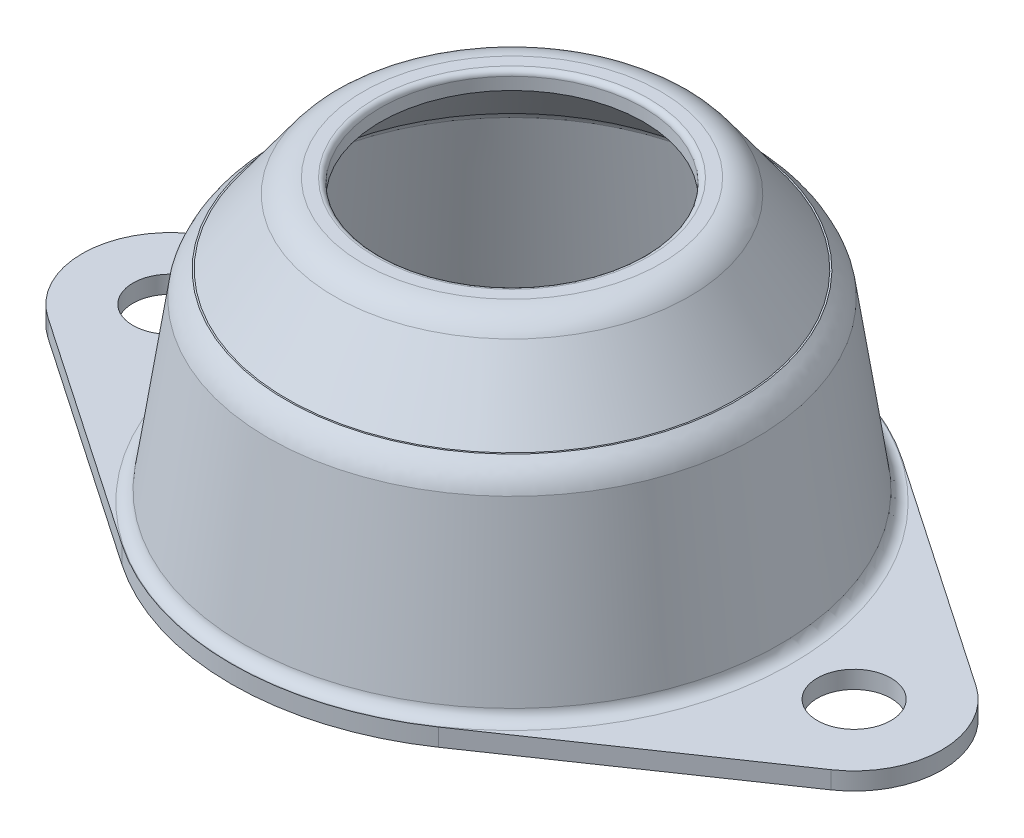
from build123d import *

# Parameters (mm, degrees)
R_VOL_MINCE1_OUTLINE_W   = 0.007571627
R_VOL_MINCE1_OUTLINE_H   = 0.3920495
R_VOL_MINCE1_OUTLINE_W_2 = 0.976658528
R_VOL_MINCE1_OUTLINE_H_2 = 0.231591764
ESQUISSE2_R              = 2.1
ESQUISSE2_R_2            = 14.5
BOSS_EXTRU_1_DEPTH       = 1
CONG_1_R                 = 0.7
CONG_2_R                 = 0.3


# Read off the part's stored shape, not the designer's step: Révol.-Mince1
with BuildPart() as part:
    # Révol.-Mince1 outline → Révol.-Mince1 (revolve)
    with BuildSketch(Plane.XY):
        with BuildLine():
            Line((7.5, 17), (7.5, 16))
            Line((7.5, 16), (8.491270905, 16))
            ThreePointArc((8.491270905, 16), (8.94469782, 15.89129346), (9.299543794, 15.588808065))
            Line((9.299543794, 15.588808065), (11.571523179, 12.47))
            Line((11.571523179, 12.47), (12.5, 12.47))
            Line((12.5, 12.47), (12.5, 12.893800849))
            Line((12.5, 12.893800849), (10.107816683, 16.177616129))
            ThreePointArc((10.107816683, 16.177616129), (9.398124736, 16.782586921), (8.491270905, 17))
            Line((8.491270905, 17), (7.5, 17))
        make_face()
        Polygon((12.5, 12.47), (11.571523179, 12.47), (12.3, 11.47), (12.5, 11.47), align=None)
        Polygon((12.5, 12.893800849), (12.5, 12.47), (12.808729095, 12.47), align=None)
        Polygon((12.808729095, 12.47), (12.5, 12.47), (12.5, 11.47), (12.892428373, 11.47), (12.892428373, 12.47), align=None)
        with BuildLine():
            Line((12.892428373, 11.47), (12.5, 11.47))
            add(Edge.make_bspline(
                [(12.801834176, 11.0779505), (12.686238359, 11.297221706), (12.5, 11.47)],
                knots=[0.333971607, 0.333971607, 0.333971607, 1, 1, 1], degree=2))
            Line((12.801834176, 11.0779505), (12.892428373, 11.0779505))
            Line((12.892428373, 11.0779505), (12.892428373, 11.47))
        make_face()
        with BuildLine():
            add(Edge.make_bspline(
                [(12.9, 12.462975599), (12.897476124, 12.465317066), (12.894952248, 12.467658533), (12.892428373, 12.47)],
                knots=[0.991680034, 0.991680034, 0.991680034, 0.991680034, 1, 1, 1, 1], degree=3))
            Line((12.892428373, 12.47), (12.892428373, 11.47))
            Line((12.892428373, 11.47), (12.9, 11.47))
            Line((12.9, 11.47), (12.9, 12.462975599))
        make_face()
        with BuildLine():
            Line((12.892428373, 11.0779505), (12.801834176, 11.0779505))
            add(Edge.make_bspline(
                [(12.892428373, 10.868711363), (12.854448818, 10.978146923), (12.801834176, 11.0779505)],
                knots=[0.030821836, 0.030821836, 0.030821836, 0.333971607, 0.333971607, 0.333971607], degree=2))
            Line((12.892428373, 10.868711363), (12.892428373, 11.0779505))
        make_face()
        with Locations((12.896214186, 11.27397525)):
            Rectangle(R_VOL_MINCE1_OUTLINE_W, R_VOL_MINCE1_OUTLINE_H)
        with BuildLine():
            add(Edge.make_bspline(
                [(13.724014392, 11.47), (13.719202707, 11.479925565), (13.714323748, 11.489820846), (13.633178057, 11.651645326), (13.540873317, 11.796040705), (13.381756728, 11.995490826), (13.325317424, 12.059137243), (13.251089091, 12.134794608), (13.228544986, 12.15720053), (13.205604181, 12.179163391), (13.190224008, 12.19370632), (13.181560449, 12.201764459), (13.157861099, 12.223750978), (13.065587572, 12.309355591), (12.973314046, 12.394960203), (12.9, 12.462975599)],
                knots=[0.233772362, 0.233772362, 0.233772362, 0.233772362, 0.25, 0.25, 0.5, 0.5, 0.625, 0.625, 0.65625, 0.671875, 0.671875, 0.6875, 0.6875, 0.75, 0.991680034, 0.991680034, 0.991680034, 0.991680034], degree=3))
            Line((12.9, 12.462975599), (12.9, 11.47))
            Line((12.9, 11.47), (13.724014392, 11.47))
        make_face()
        with BuildLine():
            Line((12.892428373, 11.0779505), (12.892428373, 10.868711363))
            add(Edge.make_bspline(
                [(12.9, 10.846358736), (12.896289829, 10.857584833), (12.892428373, 10.868711363)],
                knots=[0, 0, 0, 0.030821836, 0.030821836, 0.030821836], degree=2))
            Line((12.9, 10.846358736), (12.9, 11.0779505))
            Line((12.9, 11.0779505), (12.892428373, 11.0779505))
        make_face()
        with BuildLine():
            Line((13.724014392, 11.47), (12.9, 11.47))
            Line((12.9, 11.47), (12.9, 11.0779505))
            Line((12.9, 11.0779505), (13.876658528, 11.0779505))
            add(Edge.make_bspline(
                [(13.876658528, 11.0779505), (13.868496738, 11.102646143), (13.860334948, 11.127341786), (13.848092262, 11.16438525), (13.840518996, 11.18708214), (13.82647434, 11.226996021), (13.819202463, 11.246876541), (13.785496409, 11.335579036), (13.756266672, 11.40346985), (13.724014392, 11.47)],
                knots=[0, 0, 0, 0, 0.0625, 0.0625, 0.09375, 0.09375, 0.125, 0.125, 0.233772362, 0.233772362, 0.233772362, 0.233772362], degree=3))
        make_face()
        Polygon((13.876658528, 10.846358736), (12.9, 10.846358736), (13.876658528, 4.225615763), align=None)
        with Locations((13.388329264, 10.962154618)):
            Rectangle(R_VOL_MINCE1_OUTLINE_W_2, R_VOL_MINCE1_OUTLINE_H_2)
        Polygon((13.910821774, 10.846358736), (13.876658528, 11.0779505), (13.876658528, 10.846358736), align=None)
        Polygon((13.876658528, 10.846358736), (13.876658528, 4.225615763), (14.5, 0), (15.489294083, 0.145935661), (13.910821774, 10.846358736), align=None)
    revolve(axis=Axis((0, 0, 0), (0, 1, 0)))

    # Esquisse2 → Boss.-Extru.1 (add)
    with BuildSketch(Plane(origin=(0, 0, 0), x_dir=(1, 0, 0), z_dir=(0, 1, 0))):
        with BuildLine():
            Line((-22.320512821, 4.128523638), (-9.025641026, 13.211275642))
            ThreePointArc((-9.025641026, 13.211275642), (0, 16), (9.025641026, 13.211275642))
            Line((9.025641026, 13.211275642), (22.320512821, 4.128523638))
            ThreePointArc((22.320512821, 4.128523638), (24.5, 0), (22.320512821, -4.128523638))
            Line((22.320512821, -4.128523638), (9.025641026, -13.211275642))
            ThreePointArc((9.025641026, -13.211275642), (0, -16), (-9.025641026, -13.211275642))
            Line((-9.025641026, -13.211275642), (-22.320512821, -4.128523638))
            ThreePointArc((-22.320512821, -4.128523638), (-24.5, 0), (-22.320512821, 4.128523638))
        make_face()
        with Locations(Location((-19.5, 0, 0), (0, 0, 270))):
            Circle(ESQUISSE2_R, mode=Mode.SUBTRACT)
        with Locations(Location((19.5, 0, 0), (0, 0, 90))):
            Circle(ESQUISSE2_R, mode=Mode.SUBTRACT)
        Circle(ESQUISSE2_R_2, mode=Mode.SUBTRACT)
    extrude(amount=BOSS_EXTRU_1_DEPTH)

    # Congé1
    cong_1_edges = [part.edges().sort_by_distance(p)[0] for p in [
        (-15.36330683, 1, 0),
    ]]
    fillet(cong_1_edges, radius=CONG_1_R)

    # Congé2
    cong_2_edges = [part.edges().sort_by_distance(p)[0] for p in [
        (-7.5, 17, 0),
    ]]
    fillet(cong_2_edges, radius=CONG_2_R)


solid = part.part
